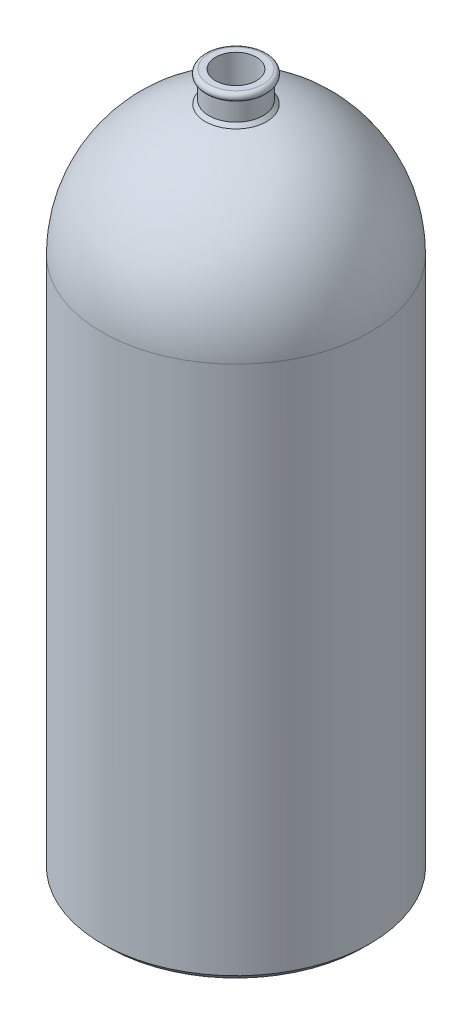
from build123d import *

# Parameters (mm, degrees)
CHANFREIN1_SIZE    = 0.2
CHANFREIN2_SIZE    = 0.5
CHANFREIN3_SIZE    = 0.2
ESQUISSE2_R        = 10
BOSS_EXTRU_1_DEPTH = 0.5
CONG_1_R           = 1
CONG_2_R           = 0.2
ECHELLE1_SCALE     = 10


with BuildPart() as part:
    # Esquisse1 → Révolution1 (revolve)
    with BuildSketch(Plane.XY, mode=Mode.PRIVATE) as r_volution1_sk:
        with BuildLine():
            Line((0, 0), (0, 50))
            Line((0, 50), (0, 52))
            Line((0, 52), (-2, 52))
            ThreePointArc((-2, 52), (-2.299732451, 51.712667184), (-2.025311774, 51.401069717))
            Line((-2.025311774, 51.401069717), (-2.025311774, 49.792758152))
            ThreePointArc((-2.025311774, 49.792758152), (-7.754131729, 46.314542037), (-10, 40))
            Line((-10, 40), (-10, 0))
            Line((-10, 0), (-8.354852758, 0))
            Line((-8.354852758, 0), (-8.354852758, 0.3))
            Line((-8.354852758, 0.3), (-7.354852758, 0.3))
            Line((-7.354852758, 0.3), (-7.354852758, 0))
            Line((-7.354852758, 0), (-6.354852758, 0))
            Line((-6.354852758, 0), (-6.354852758, 0.3))
            Line((-6.354852758, 0.3), (-5.354852758, 0.3))
            Line((-5.354852758, 0.3), (-5.354852758, 0))
            Line((-5.354852758, 0), (-2.025311774, 0))
            Line((-2.025311774, 0), (-2.025311774, 0.3))
            Line((-2.025311774, 0.3), (-1.025311774, 0.3))
            Line((-1.025311774, 0.3), (-1.025311774, 0))
            Line((-1.025311774, 0), (0, 0))
        make_face()
    revolve(r_volution1_sk.sketch.rotate(Axis((0, 0, 0), (0, 1, 0)), 180), axis=Axis((0, 0, 0), (0, 1, 0)))

    # Chanfrein1
    chanfrein1_edges = [part.edges().sort_by_distance(p)[0] for p in [
        (-1.025311774, 0, 0),
        (-2.025311774, 0, 0),
        (-5.354852758, 0, 0),
        (-6.354852758, 0, 0),
        (-7.354852758, 0, 0),
        (-8.354852758, 0, 0),
    ]]
    chamfer(chanfrein1_edges, length=CHANFREIN1_SIZE)

    # Chanfrein2
    chanfrein2_edges = [part.edges().sort_by_distance(p)[0] for p in [
        (-10, 0, 0),
    ]]
    chamfer(chanfrein2_edges, length=CHANFREIN2_SIZE)

    # Coque2: read off the stored shape, not the designer's step
    # Coque2 outline → Coque2 (revolve, cut)
    with BuildSketch(Plane.XY):
        with BuildLine():
            Line((8.854852758, 0.8), (8.854852758, 0.5))
            Line((8.854852758, 0.5), (9.292893219, 0.5))
            Line((9.292893219, 0.5), (9.5, 0.707106781))
            Line((9.5, 0.707106781), (9.5, 39.999999997))
            ThreePointArc((9.5, 39.999999997), (7.236727916, 46.154654261), (1.525311771, 49.376749117))
            Line((1.525311771, 49.376749117), (1.525311774, 52))
            Line((1.525311774, 52), (0, 52))
            Line((0, 52), (0, 0.5))
            Line((0, 0.5), (0.525311774, 0.5))
            Line((0.525311774, 0.5), (0.525311774, 0.8))
            Line((0.525311774, 0.8), (2.525311774, 0.8))
            Line((2.525311774, 0.8), (2.525311774, 0.5))
            Line((2.525311774, 0.5), (4.854852758, 0.5))
            Line((4.854852758, 0.5), (4.854852758, 0.8))
            Line((4.854852758, 0.8), (8.854852758, 0.8))
        make_face()
    revolve(axis=Axis((0, 0, 0), (0, 1, 0)), mode=Mode.SUBTRACT)

    # Chanfrein3
    # the kernel refuses this chamfer: 0.25748488, 0.2 mm, written as the material it adds along each edge
    with BuildSketch(Plane(origin=(0, 49.792758152, 0), x_dir=(1, 0, 0), z_dir=(0, 0, 1))) as chanfrein3_piece_1:
        with BuildLine():
            Line((2.281904858, -0.056593084), (2.025311774, CHANFREIN3_SIZE))
            Line((2.025311774, CHANFREIN3_SIZE), (2.025311774, 0))
            ThreePointArc((2.025311774, 0), (2.158033883, -0.028389777), (2.281904858, -0.056593084))
        make_face()
    revolve(axis=Axis((0, 49.792758152, 0), (0, 1, 0)))

    # Esquisse2 → Boss.-Extru.1 (add)
    with BuildSketch(Plane(origin=(0, 0.5, 0), x_dir=(1, 0, 0), z_dir=(0, 1, 0))):
        Circle(ESQUISSE2_R)
    extrude(amount=BOSS_EXTRU_1_DEPTH)

    # Congé1
    cong_1_edges = [part.edges().sort_by_distance(p)[0] for p in [
        (-9.5, 1, 0),
    ]]
    fillet(cong_1_edges, radius=CONG_1_R)

    # Congé2
    cong_2_edges = [part.edges().sort_by_distance(p)[0] for p in [
        (-1.525311771, 49.376749117, 0),
    ]]
    fillet(cong_2_edges, radius=CONG_2_R)


with BuildPart() as part_1:
    # Echelle1: scaled about (0, 0, 0)
    add(part.part.scale(ECHELLE1_SCALE))


solid = part_1.part
